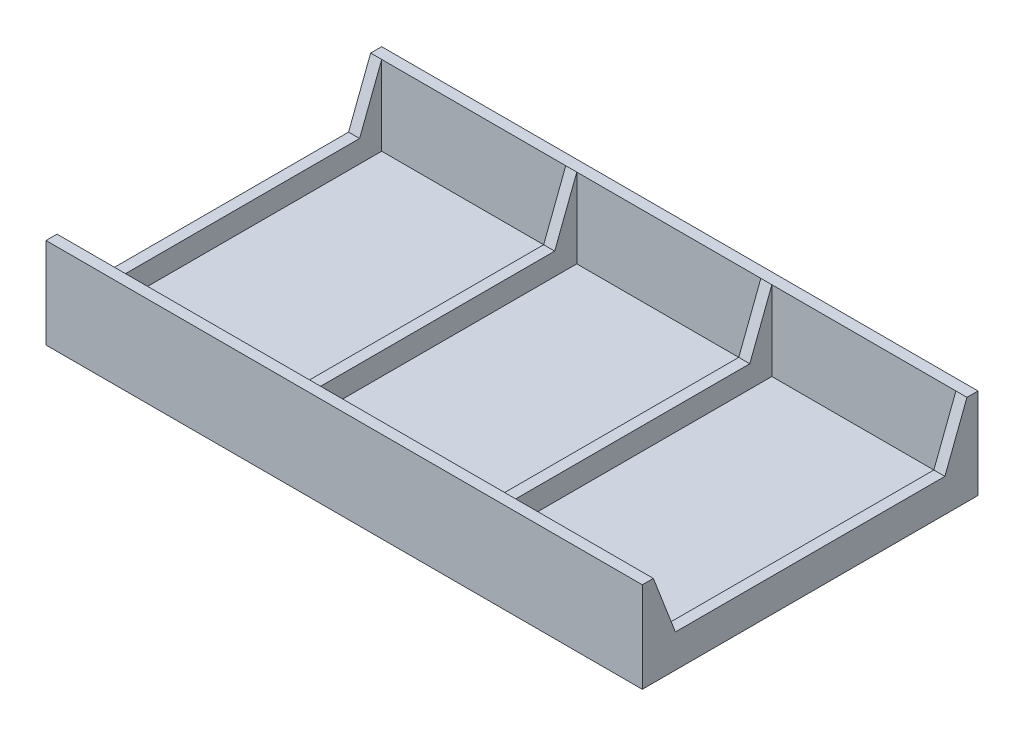
from build123d import *
from OCP.BRepFilletAPI import BRepFilletAPI_MakeChamfer

# Parameters (mm, degrees)
SKETCH1_W           = 68.58
SKETCH1_H           = 38.608
BOSS_EXTRUDE1_DEPTH = 1.27
SKETCH2_W           = 68.58
SKETCH2_H           = 1.27
BOSS_EXTRUDE2_DEPTH = 9.144
SKETCH4_W           = 1.27
SKETCH4_H           = 36.068
BOSS_EXTRUDE4_DEPTH = 2.54
CHAMFER2_SIZE       = 6.604
CHAMFER2_SIZE_2     = 2.540000001


with BuildPart() as part:
    # Sketch1 → Boss-Extrude1 (new body)
    with BuildSketch(Plane(origin=(0, 0, 0), x_dir=(1, 0, 0), z_dir=(0, 1, 0))):
        with Locations((34.29, 19.304)):
            Rectangle(SKETCH1_W, SKETCH1_H)
    extrude(amount=BOSS_EXTRUDE1_DEPTH)

    # Sketch2 → Boss-Extrude2 (add)
    with BuildSketch(Plane(origin=(0, 1.27, 0), x_dir=(1, 0, 0), z_dir=(0, 1, 0))):
        with Locations((34.29, 37.973)):
            Rectangle(SKETCH2_W, SKETCH2_H)
        with Locations((34.29, 0.635)):
            Rectangle(SKETCH2_W, SKETCH2_H)
    extrude(amount=BOSS_EXTRUDE2_DEPTH)

    # Sketch4 → Boss-Extrude4 (add)
    with BuildSketch(Plane(origin=(0, 1.27, 0), x_dir=(1, 0, 0), z_dir=(0, 1, 0))):
        with Locations((0.635, 19.304)):
            Rectangle(SKETCH4_W, SKETCH4_H)
        with Locations((23.071666667, 19.304)):
            Rectangle(SKETCH4_W, SKETCH4_H)
        with Locations((45.508333333, 19.304)):
            Rectangle(SKETCH4_W, SKETCH4_H)
        with Locations((67.945, 19.304)):
            Rectangle(SKETCH4_W, SKETCH4_H)
    extrude(amount=BOSS_EXTRUDE4_DEPTH)

    # Chamfer2
    chamfer2_edges_1 = [part.edges().sort_by_distance(p)[0] for p in [
        (67.945, 3.81, -37.338),
    ]]
    chamfer2_side_1 = [part.faces().sort_by_distance(p)[0] for p in [
        (67.945, 3.8608, -37.338),
    ]]
    chamfer2_edges_2 = [part.edges().sort_by_distance(p)[0] for p in [
        (45.508333333, 3.81, -37.338),
    ]]
    chamfer2_side_2 = [part.faces().sort_by_distance(p)[0] for p in [
        (45.508333333, 3.8608, -37.338),
    ]]
    chamfer2_edges_3 = [part.edges().sort_by_distance(p)[0] for p in [
        (23.071666667, 3.81, -37.338),
    ]]
    chamfer2_side_3 = [part.faces().sort_by_distance(p)[0] for p in [
        (23.071666667, 3.8608, -37.338),
    ]]
    chamfer2_edges_4 = [part.edges().sort_by_distance(p)[0] for p in [
        (0.635, 3.81, -37.338),
    ]]
    chamfer2_side_4 = [part.faces().sort_by_distance(p)[0] for p in [
        (0.635, 3.8608, -37.338),
    ]]
    chamfer2_edges_5 = [part.edges().sort_by_distance(p)[0] for p in [
        (67.945, 3.81, -1.27),
    ]]
    chamfer2_side_5 = [part.faces().sort_by_distance(p)[0] for p in [
        (67.945, 3.8608, -1.27),
    ]]
    chamfer2_edges_6 = [part.edges().sort_by_distance(p)[0] for p in [
        (45.508333333, 3.81, -1.27),
    ]]
    chamfer2_side_6 = [part.faces().sort_by_distance(p)[0] for p in [
        (45.508333333, 3.8608, -1.27),
    ]]
    chamfer2_edges_7 = [part.edges().sort_by_distance(p)[0] for p in [
        (23.071666667, 3.81, -1.27),
    ]]
    chamfer2_side_7 = [part.faces().sort_by_distance(p)[0] for p in [
        (23.071666667, 3.8608, -1.27),
    ]]
    chamfer2_edges_8 = [part.edges().sort_by_distance(p)[0] for p in [
        (0.635, 3.81, -1.27),
    ]]
    chamfer2_side_8 = [part.faces().sort_by_distance(p)[0] for p in [
        (0.635, 3.8608, -1.27),
    ]]
    chamfer2 = BRepFilletAPI_MakeChamfer(part.part.solid().wrapped)
    for e in chamfer2_edges_1:
        chamfer2.Add(CHAMFER2_SIZE - 0.0001, CHAMFER2_SIZE_2 - 0.0001, e.wrapped, chamfer2_side_1[0].wrapped)
    for e in chamfer2_edges_2:
        chamfer2.Add(CHAMFER2_SIZE - 0.0001, CHAMFER2_SIZE_2 - 0.0001, e.wrapped, chamfer2_side_2[0].wrapped)
    for e in chamfer2_edges_3:
        chamfer2.Add(CHAMFER2_SIZE - 0.0001, CHAMFER2_SIZE_2 - 0.0001, e.wrapped, chamfer2_side_3[0].wrapped)
    for e in chamfer2_edges_4:
        chamfer2.Add(CHAMFER2_SIZE - 0.0001, CHAMFER2_SIZE_2 - 0.0001, e.wrapped, chamfer2_side_4[0].wrapped)
    for e in chamfer2_edges_5:
        chamfer2.Add(CHAMFER2_SIZE - 0.0001, CHAMFER2_SIZE_2 - 0.0001, e.wrapped, chamfer2_side_5[0].wrapped)
    for e in chamfer2_edges_6:
        chamfer2.Add(CHAMFER2_SIZE - 0.0001, CHAMFER2_SIZE_2 - 0.0001, e.wrapped, chamfer2_side_6[0].wrapped)
    for e in chamfer2_edges_7:
        chamfer2.Add(CHAMFER2_SIZE - 0.0001, CHAMFER2_SIZE_2 - 0.0001, e.wrapped, chamfer2_side_7[0].wrapped)
    for e in chamfer2_edges_8:
        chamfer2.Add(CHAMFER2_SIZE - 0.0001, CHAMFER2_SIZE_2 - 0.0001, e.wrapped, chamfer2_side_8[0].wrapped)
    add(Compound.cast(chamfer2.Shape()), mode=Mode.REPLACE)  # a hair under: the kernel refuses the full size


solid = part.part
